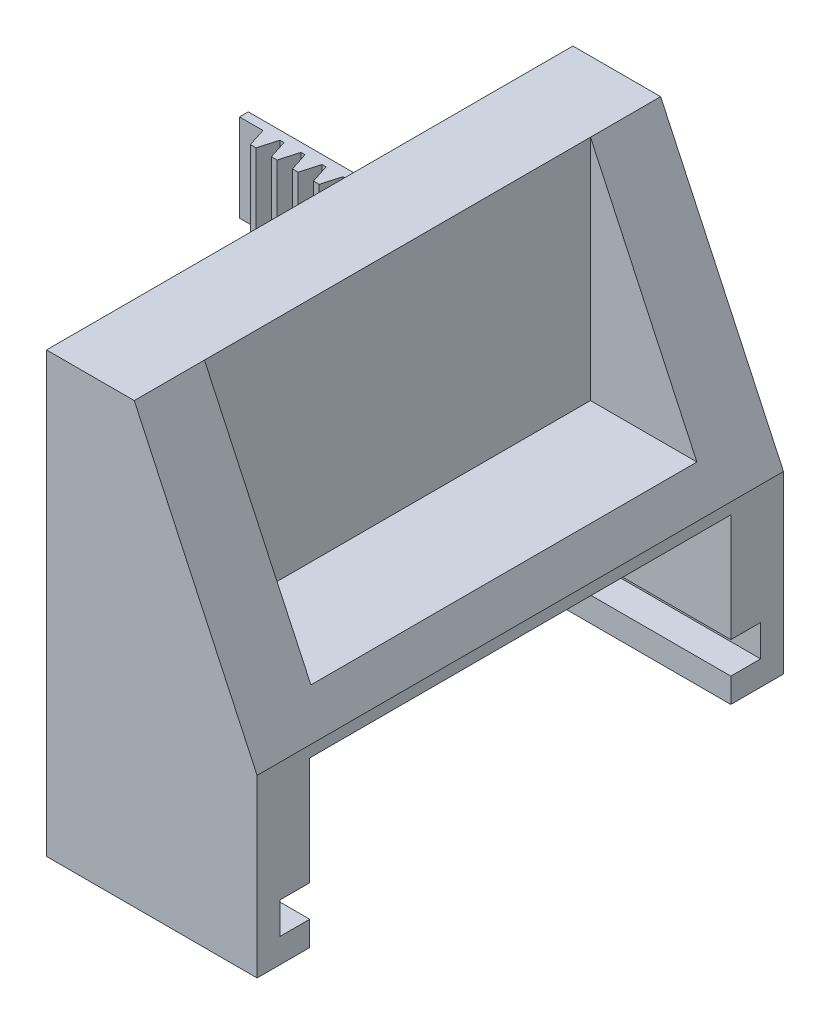
from build123d import *

# Parameters (mm, degrees)
BOSS_EXTRUDE1_DEPTH = 30
SKETCH4_W           = 24
SKETCH4_H           = 14
CUT_EXTRUDE2_DEPTH  = 25
SKETCH5_W           = 1.7
SKETCH5_H           = 1.8
CUT_EXTRUDE3_DEPTH  = 15
CUT_EXTRUDE4_DEPTH  = 11
BOSS_EXTRUDE2_DEPTH = 5


with BuildPart() as part:
    # Sketch1 → Boss-Extrude1 (new body)
    with BuildSketch(Plane.XY):
        Polygon((0, 0), (0, -25), (12, -25), (12, -15), (5, 0), align=None)
    extrude(amount=-BOSS_EXTRUDE1_DEPTH)

    # Sketch4 → Cut-Extrude2 (cut)
    with BuildSketch(Plane.ZY):
        with Locations((-15, -22.638599401)):
            Rectangle(SKETCH4_W, SKETCH4_H)
    extrude(amount=-CUT_EXTRUDE2_DEPTH, mode=Mode.SUBTRACT)

    # Sketch5 → Cut-Extrude3 (cut)
    with BuildSketch(Plane.ZY):
        with Locations((-2.15, -22.7)):
            Rectangle(SKETCH5_W, SKETCH5_H)
    cut_extrude3 = extrude(amount=-CUT_EXTRUDE3_DEPTH, mode=Mode.SUBTRACT)

    # Mirror1: Cut-Extrude3 across plane
    add(cut_extrude3.mirror(Plane.XY.offset(-15)), mode=Mode.SUBTRACT)

    # Sketch6 → Cut-Extrude4 (cut, symmetric)
    with BuildSketch(Plane.XY.offset(-15)):
        Polygon((5, 0), (5, -13), (11.066666667, -13), align=None)
    extrude(amount=CUT_EXTRUDE4_DEPTH, both=True, mode=Mode.SUBTRACT)

    # Sketch7 → Boss-Extrude2 (add)
    with BuildSketch(Plane(origin=(0, -15, 0), x_dir=(1, 0, 0), z_dir=(0, 1, 0))):
        Polygon((0, 27.5), (-16, 27.5), (-16, 27), (-14.9, 27), (-14.665549599, 27), (-14.327251213, 25.943471152), (-14.004330027, 25.943471152), (-13.7, 27), (-13.465549599, 27), (-13.127251213, 25.943471152), (-12.804330027, 25.943471152), (-12.5, 27), (-12.265549599, 27), (-11.927251213, 25.943471152), (-11.604330027, 25.943471152), (-11.3, 27), (-11.065549599, 27), (-10.727251213, 25.943471152), (-10.404330027, 25.943471152), (-10.1, 27), (-9.865549599, 27), (-9.527251213, 25.943471152), (-9.204330027, 25.943471152), (-8.9, 27), (-8.665549599, 27), (-8.327251213, 25.943471152), (-8.004330027, 25.943471152), (-7.7, 27), (-7.465549599, 27), (-7.127251213, 25.943471152), (-6.804330027, 25.943471152), (-6.5, 27), (-6.265549599, 27), (-5.927251213, 25.943471152), (-5.604330027, 25.943471152), (-5.3, 27), (-5.065549599, 27), (-4.727251213, 25.943471152), (-4.404330027, 25.943471152), (-4.1, 27), (-3.865549599, 27), (-3.527251213, 25.943471152), (-3.204330027, 25.943471152), (-2.9, 27), (-2.665549599, 27), (-2.327251213, 25.943471152), (-2.004330027, 25.943471152), (-1.7, 27), (-1.465549599, 27), (-1.127251213, 25.943471152), (-0.804330027, 25.943471152), (-0.5, 27), (0, 27), align=None)
    extrude(amount=BOSS_EXTRUDE2_DEPTH)


solid = part.part
